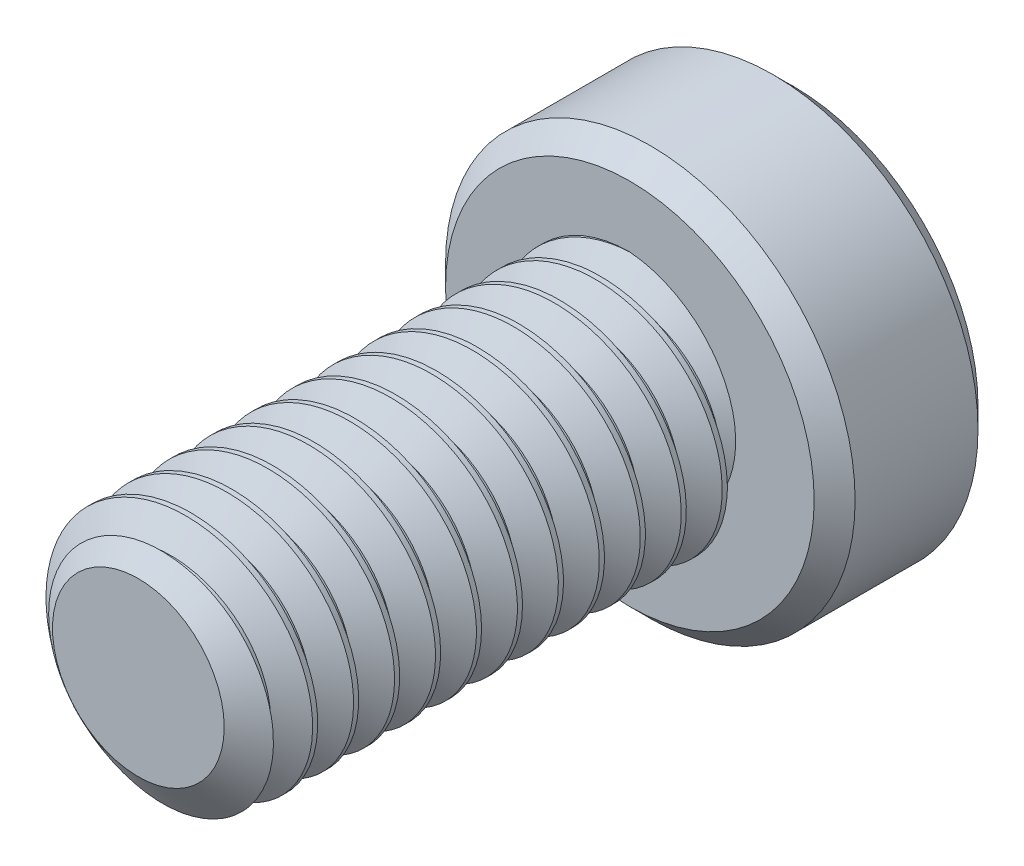
from build123d import *

# Parameters (mm, degrees)
SKETCH1_R          = 3
EXTRUDE1_DEPTH     = 12
CUT_SWEEP1_PITCH   = 1
SKETCH6_R          = 5
EXTRUDE2_DEPTH     = 4
CUT_EXTRUDE1_DEPTH = 3
CHAMFER1_SIZE      = 0.5


with BuildPart() as part:
    # Sketch1 → Extrude1 (new body)
    with BuildSketch(Plane.XY):
        Circle(SKETCH1_R)
    extrude(amount=-EXTRUDE1_DEPTH)

    # Cut-Sweep1: the profile of Sketch3 profile screwed along a right-hand helix of 13 turns, 6 arcs to a turn; built about Z, then put on its axis
    cut_sweep1_z = Axis((0, 0, 0), (0, 0, 1))
    cut_sweep1_corners = [(3.0003, 0, -0.875173205), (2.350480947, 0, -0.5), (2.350480947, 0, -0.375), (3.0003, 0, 0.000173205)]
    with BuildLine(mode=Mode.PRIVATE) as cut_sweep1_profile:
        Line(cut_sweep1_corners[0], cut_sweep1_corners[1])
        Line(cut_sweep1_corners[1], cut_sweep1_corners[2])
        Line(cut_sweep1_corners[2], cut_sweep1_corners[3])
        Line(cut_sweep1_corners[3], cut_sweep1_corners[0])
    cut_sweep1_cap = Face(cut_sweep1_profile.wire())
    cut_sweep1_turn_angles = [0, 30, 60, 90, 120, 150, 180, 210, 240, 270, 300, 330, 360]
    cut_sweep1_turn_weights = [1, 0.8660254037844387, 1, 0.8660254037844387, 1, 0.8660254037844387, 1, 0.8660254037844387, 1, 0.8660254037844387, 1, 0.8660254037844387, 1]
    cut_sweep1_turn_rails = [Edge.make_bspline([Vector(p[0], p[1], 0).rotate(cut_sweep1_z, cut_sweep1_turn_angles[k]) / cut_sweep1_turn_weights[k] + Vector(0, 0, p[2] + CUT_SWEEP1_PITCH * cut_sweep1_turn_angles[k] / 360) for k in range(13)], [0, 0, 0, 1, 1, 2, 2, 3, 3, 4, 4, 5, 5, 6, 6, 6], 2, cut_sweep1_turn_weights) for p in cut_sweep1_corners]
    cut_sweep1_turn_sides = [Face.make_surface_from_curves(cut_sweep1_turn_rails[p[0]], cut_sweep1_turn_rails[p[1]]) for p in [(0, 1), (1, 2), (2, 3), (3, 0)]]
    cut_sweep1 = Plane(origin=(0, 0, 0), x_dir=(0, 1, 0), z_dir=(0, 0, -1)) * Solid(Shell([*[p.moved(Location((0, 0, CUT_SWEEP1_PITCH * i))) for i in range(13) for p in cut_sweep1_turn_sides], cut_sweep1_cap, cut_sweep1_cap.rotate(cut_sweep1_z, 4680).moved(Location((0, 0, CUT_SWEEP1_PITCH * 4680 / 360)))]))
    add(cut_sweep1, mode=Mode.SUBTRACT)

    # Sketch4 → Cut-Revolve1 (revolve, cut)
    with BuildSketch(Plane(origin=(0, 0, 0), x_dir=(0, 0, -1), z_dir=(1, 0, 0)), mode=Mode.PRIVATE) as cut_revolve1_sk:
        Polygon((0.632650852, 3), (0, 2.096480947), (0, 3), align=None)
    revolve(cut_revolve1_sk.sketch.rotate(Axis((0, 0, 0), (0, 0, -1)), 244.349292568), axis=Axis((0, 0, 0), (0, 0, -1)), mode=Mode.SUBTRACT)

    # Sketch6 → Extrude2 (add)
    with BuildSketch(Plane(origin=(0, 0, -12), x_dir=(-1, 0, 0), z_dir=(0, 0, -1))):
        Circle(SKETCH6_R)
    extrude(amount=EXTRUDE2_DEPTH)

    # Sketch7 → Cut-Extrude1 (cut)
    with BuildSketch(Plane(origin=(0, 0, -16), x_dir=(-1, 0, 0), z_dir=(0, 0, -1))):
        Polygon((0, 2.309401077), (-2, 1.154700538), (-2, -1.154700538), (0, -2.309401077), (2, -1.154700538), (2, 1.154700538), align=None)
    extrude(amount=-CUT_EXTRUDE1_DEPTH, mode=Mode.SUBTRACT)

    # Cut-Extrude2 cone 1 section (through the dimple's axis) → Cut-Extrude2 (revolve, cut)
    with BuildSketch(Plane(origin=(0, 0, -16), x_dir=(0, 1, 0), z_dir=(1, 0, 0))):
        Polygon((0, 0), (2.309401077, 0), (0, 2.309401077), align=None)
    revolve(axis=Axis((0, 0, -16), (0, 0, 1)), mode=Mode.SUBTRACT)

    # Chamfer1
    chamfer1_edges = [part.edges().sort_by_distance(p)[0] for p in [
        (5, 0, -12),
        (5, 0, -16),
    ]]
    chamfer(chamfer1_edges, length=CHAMFER1_SIZE)


solid = part.part
